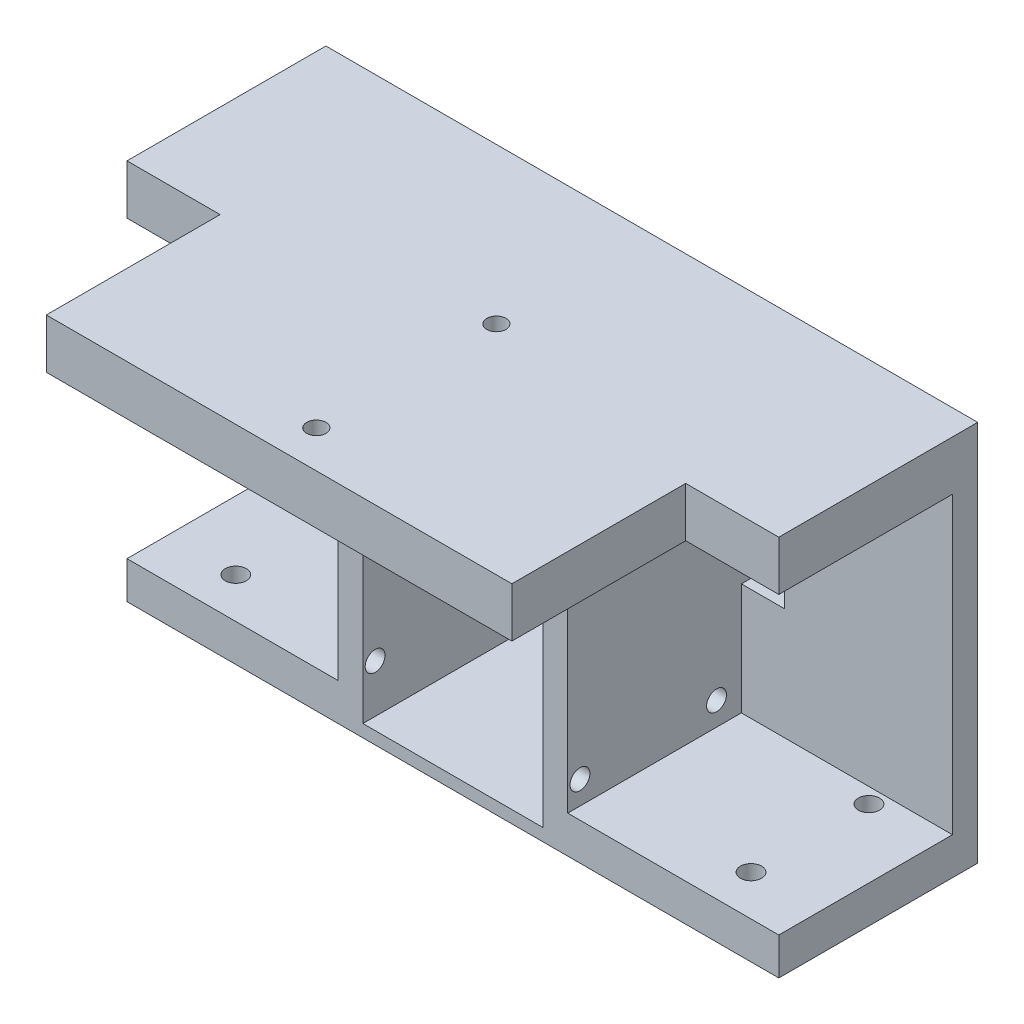
from build123d import *

# Parameters (mm, degrees)
BOSS_EXTRU_1_DEPTH         = 4.07
BOSS_EXTRU_1_2_DEPTH       = 4.07
ESQUISSE1_3_W              = 15
ESQUISSE1_3_H              = 8
BOSS_EXTRU_2_DEPTH         = 32.04
BOSS_EXTRU_3_DEPTH         = 60.04
D_GAGEMENT_M31_D           = 3.2
D_GAGEMENT_M32_D           = 3.4
D_GAGEMENT_M32_DEPTH       = 6
D_GAGEMENT_START           = 22.75
D_GAGEMENT_M2_51_OUTLINE_R = 1.55
D_GAGEMENT_M2_51_DEPTH     = 8


# Read off the part's stored shape, not the designer's step: Dégagement M2.51
with BuildPart() as part:
    # Esquisse1 → Boss.-Extru.1 (new body)
    with BuildSketch(Plane.XY):
        Polygon((-52.5, -24.75), (-18.5, -24.75), (-18.5, -6.75), (-25.445395167, -6.75), (-25.445395167, 8.75), (-18.5, 8.75), (-18.5, 22.75), (-52.5, 22.75), align=None)
    extrude(amount=BOSS_EXTRU_1_DEPTH)



with BuildPart() as body_2:
    # Esquisse1 → Boss.-Extru.1 2 (new body)
    with BuildSketch(Plane.XY):
        Polygon((18.5, -24.75), (52.5, -24.75), (52.5, 22.75), (37.5, 22.75), (18.5, 22.75), (18.5, 8.75), (25.445395167, 8.75), (25.445395167, -6.75), (18.5, -6.75), align=None)
    extrude(amount=BOSS_EXTRU_1_2_DEPTH)


with BuildPart() as part_1:
    add(part.part)

    add(body_2.part)  # Boss.-Extru.2 merges body 2
    # Esquisse1<3> → Boss.-Extru.2 (add)
    with BuildSketch(Plane.XY):
        with Locations((-45, 26.75)):
            Rectangle(ESQUISSE1_3_W, ESQUISSE1_3_H)
        Polygon((-18.5, 8.75), (-18.5, -6.75), (-18.5, -24.75), (-52.5, -24.75), (-52.5, -30.75), (52.5, -30.75), (52.5, -24.75), (18.5, -24.75), (18.5, -6.75), (18.5, 8.75), (18.5, 22.75), (14.5, 22.75), (14.5, -28.75), (-14.5, -28.75), (-14.5, 22.75), (-18.5, 22.75), align=None)
        with Locations((45, 26.75)):
            Rectangle(ESQUISSE1_3_W, ESQUISSE1_3_H)
    extrude(amount=BOSS_EXTRU_2_DEPTH)

    # Esquisse1<4> → Boss.-Extru.3 (add)
    with BuildSketch(Plane.XY):
        Polygon((-37.5, 22.75), (-18.5, 22.75), (-14.5, 22.75), (14.5, 22.75), (18.5, 22.75), (37.5, 22.75), (37.5, 30.75), (-37.5, 30.75), align=None)
    extrude(amount=BOSS_EXTRU_3_DEPTH)

    # Dégagement M31 (through all)
    with Locations(Plane.ZY.offset(18.5)):
        with Locations((8.07, -21), (8.07, 19), (30.07, 19), (30.07, -21)):
            Hole(D_GAGEMENT_M31_D / 2)

    # Dégagement M32
    with Locations(Plane(origin=(0, -30.75, 0), x_dir=(-1, 0, 0), z_dir=(0, -1, 0))):
        with Locations((-41.5, -25.52), (-41.5, -6.52), (41.5, -6.52), (41.5, -25.52)):
            Hole(D_GAGEMENT_M32_D / 2, depth=D_GAGEMENT_M32_DEPTH)

    # Dégagement M2.51 outline → Dégagement M2.51 (cut)
    with BuildSketch(Plane(origin=(0, 0, 0), x_dir=(1, 0, 0), z_dir=(0, 1, 0)).offset(D_GAGEMENT_START)):
        with Locations((0, -54.04)):
            Circle(D_GAGEMENT_M2_51_OUTLINE_R)
        with Locations((0, -25.04)):
            Circle(D_GAGEMENT_M2_51_OUTLINE_R)
    extrude(amount=D_GAGEMENT_M2_51_DEPTH, mode=Mode.SUBTRACT)


solid = part_1.part
